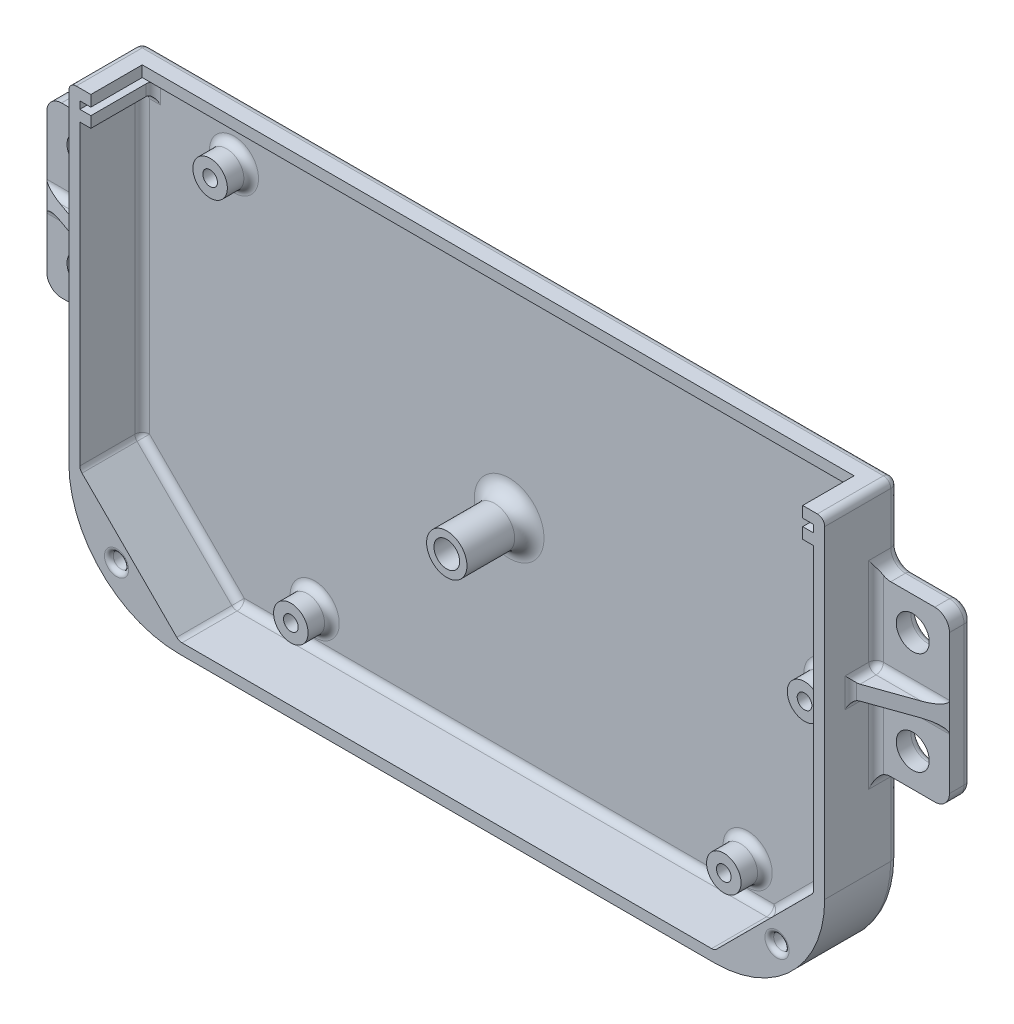
from build123d import *

# Parameters (mm, degrees)
BOSS_EXTRU_1_DEPTH      = 10
ENL_V_MAT_EXTRU_1_DEPTH = 8.5
ESQUISSE3_W             = 100
ESQUISSE3_H             = 1.5
BOSS_EXTRU_2_DEPTH      = 1.5
ESQUISSE4_W             = 1.5
ESQUISSE4_H             = 1.5
BOSS_EXTRU_3_DEPTH      = 8.5
ESQUISSE6_W             = 10
ESQUISSE6_H             = 23
ESQUISSE6_R             = 2.25
BOSS_EXTRU_5_DEPTH      = 3
CONG_3_R                = 2
CONG_4_R                = 1
CONG_5_R                = 1
BOSS_EXTRU_6_START      = 8.5
BOSS_EXTRU_6_DEPTH      = 8.5
ESQUISSE8_R             = 1.05
ENL_V_MAT_EXTRU_2_DEPTH = 5
CONG_6_R                = 1
ESQUISSE9_R             = 2.75
BOSS_EXTRU_7_DEPTH      = 8.5
CONG_7_R                = 2
ESQUISSE10_R            = 1.75
ENL_V_MAT_EXTRU_3_DEPTH = 10
CHANFREIN1_SIZE         = 2
ESQUISSE11_R            = 2.35
BOSS_EXTRU_8_DEPTH      = 3.25
ESQUISSE12_R            = 1
ENL_V_MAT_EXTRU_4_DEPTH = 2.5
CONG_8_R                = 1
CONG_9_R                = 0.6
BOSS_EXTRU_9_START      = -12
BOSS_EXTRU_9_DEPTH      = 2
CONG_10_R               = 1


# Read off the part's stored shape, not the designer's step: Boss.-Extru.9
with BuildPart() as part:
    # Esquisse1 → Boss.-Extru.1 (new body)
    with BuildSketch(Plane.XY):
        with BuildLine():
            Line((-51.5, 2), (51.5, 2))
            Line((51.5, 2), (51.5, -43))
            ThreePointArc((51.5, -43), (47.106601718, -53.606601718), (36.5, -58))
            Line((36.5, -58), (-36.5, -58))
            ThreePointArc((-36.5, -58), (-47.106601718, -53.606601718), (-51.5, -43))
            Line((-51.5, -43), (-51.5, 2))
        make_face()
    extrude(amount=BOSS_EXTRU_1_DEPTH)

    # Esquisse2 → Enlèv. mat.-Extru.1 (cut)
    with BuildSketch(Plane.XY.offset(10)):
        with BuildLine():
            Line((-50, 2), (50, 2))
            Line((50, 2), (50, -43))
            ThreePointArc((50, -43), (46.045941546, -52.545941546), (36.5, -56.5))
            Line((36.5, -56.5), (-36.5, -56.5))
            ThreePointArc((-36.5, -56.5), (-46.045941546, -52.545941546), (-50, -43))
            Line((-50, -43), (-50, 2))
        make_face()
    extrude(amount=-ENL_V_MAT_EXTRU_1_DEPTH, mode=Mode.SUBTRACT)

    # Esquisse3 → Boss.-Extru.2 (add)
    with BuildSketch(Plane.XY.offset(1.5)):
        with Locations((0, 1.25)):
            Rectangle(ESQUISSE3_W, ESQUISSE3_H)
    extrude(amount=BOSS_EXTRU_2_DEPTH)

    # Esquisse4 → Boss.-Extru.3 (add)
    with BuildSketch(Plane.XY.offset(1.5)):
        with Locations((-49.25, -1.25)):
            Rectangle(ESQUISSE4_W, ESQUISSE4_H)
        with Locations((49.25, -1.25)):
            Rectangle(ESQUISSE4_W, ESQUISSE4_H)
        with Locations((49.25, 1.25)):
            Rectangle(ESQUISSE4_W, ESQUISSE4_H)
        with Locations((-49.25, 1.25)):
            Rectangle(ESQUISSE4_W, ESQUISSE4_H)
    extrude(amount=BOSS_EXTRU_3_DEPTH)

    # Esquisse6 → Boss.-Extru.5 (add)
    # profile 1 of 2: a face of its own
    with BuildSketch(Plane(origin=(0, 0, 0), x_dir=(-1, 0, 0), z_dir=(0, 0, -1))):
        with Locations((-56.5, -19.5)):
            Rectangle(ESQUISSE6_W, ESQUISSE6_H)
        with Locations((-56.5, -12.5)):
            Circle(ESQUISSE6_R, mode=Mode.SUBTRACT)
        with Locations((-56.5, -26.5)):
            Circle(ESQUISSE6_R, mode=Mode.SUBTRACT)
    # profile 2 of 2: a face of its own
    with BuildSketch(Plane(origin=(0, 0, 0), x_dir=(-1, 0, 0), z_dir=(0, 0, -1))):
        with Locations((56.5, -19.5)):
            Rectangle(ESQUISSE6_W, ESQUISSE6_H)
        with Locations(Location((56.5, -12.5, 0), (0, 0, 180))):
            Circle(ESQUISSE6_R, mode=Mode.SUBTRACT)
        with Locations(Location((56.5, -26.5, 0), (0, 0, 180))):
            Circle(ESQUISSE6_R, mode=Mode.SUBTRACT)
    extrude(amount=-BOSS_EXTRU_5_DEPTH)

    # Congé3
    cong_3_edges = [part.edges().sort_by_distance(p)[0] for p in [
        (51.5, -8, 1.5),
        (51.5, -31, 1.5),
        (61.5, -31, 1.5),
        (61.5, -8, 1.5),
        (-51.5, -8, 1.5),
        (-61.5, -8, 1.5),
        (-61.5, -31, 1.5),
        (-51.5, -31, 1.5),
    ]]
    fillet(cong_3_edges, radius=CONG_3_R)

    # Congé4
    cong_4_edges = [part.edges().sort_by_distance(p)[0] for p in [
        (0, 2, 0),
        (51.5, -38, 0),
        (47.106601718, -53.606601718, 0),
        (58.75, -12.5, 0),
        (58.75, -26.5, 0),
        (-58.75, -12.5, 0),
        (-58.75, -26.5, 0),
        (0, -58, 0),
        (51.5, -2, 0),
        (56.5, -8, 0),
        (61.5, -19.5, 0),
        (56.5, -31, 0),
        (-51.5, -38, 0),
        (-56.5, -31, 0),
        (-61.5, -19.5, 0),
        (-56.5, -8, 0),
        (-60.914213562, -30.414213562, 0),
        (-60.914213562, -8.585786438, 0),
        (60.914213562, -30.414213562, 0),
        (60.914213562, -8.585786438, 0),
        (52.085786438, -7.414213562, 0),
        (52.085786438, -31.585786438, 0),
        (-52.085786438, -7.414213562, 0),
        (-52.085786438, -31.585786438, 0),
        (-47.106601718, -53.606601718, 0),
        (-51.5, -2, 0),
    ]]
    fillet(cong_4_edges, radius=CONG_4_R)

    # Congé5
    cong_5_edges = [part.edges().sort_by_distance(p)[0] for p in [
        (51.5, -19.5, 3),
        (-51.5, -19.5, 3),
    ]]
    fillet(cong_5_edges, radius=CONG_5_R)
    # the kernel refuses this fillet: 1 mm, written as the material it takes off along each edge
    with BuildSketch(Plane(origin=(-50.5, 1, 1), x_dir=(0, 1, 0), z_dir=(-1, 0, 0))) as cong_5_2_piece_1_section:
        Polygon((0, 0), (CONG_5_R * 1.02, 0), (CONG_5_R * 1.02, CONG_5_R * 1.02), (0, CONG_5_R * 1.02), align=None)
    cong_5_2_piece_1 = extrude(amount=CONG_5_R * 1.02, mode=Mode.PRIVATE)
    cong_5_2_piece_1 = cong_5_2_piece_1 - Plane(origin=(-50.5, 1, 1), x_dir=(0, -0.7071067811865475, 0.7071067811865475), z_dir=(-1, 0, 0)) * Sphere(CONG_5_R, mode=Mode.PRIVATE)
    add(cong_5_2_piece_1, mode=Mode.SUBTRACT)
    with BuildSketch(Plane(origin=(50.5, 1, 1), x_dir=(1, 0, 0), z_dir=(0, 1, 0))) as cong_5_2_piece_2_section:
        Polygon((0, 0), (CONG_5_R * 1.02, 0), (CONG_5_R * 1.02, CONG_5_R * 1.02), (0, CONG_5_R * 1.02), align=None)
    cong_5_2_piece_2 = extrude(amount=CONG_5_R * 1.02, mode=Mode.PRIVATE)
    cong_5_2_piece_2 = cong_5_2_piece_2 - Plane(origin=(50.5, 1, 1), x_dir=(-0.7071067811865475, 0, 0.7071067811865475), z_dir=(0, 1, 0)) * Sphere(CONG_5_R, mode=Mode.PRIVATE)
    add(cong_5_2_piece_2, mode=Mode.SUBTRACT)
    with BuildSketch(Plane(origin=(-51.5, 2, 1), x_dir=(0, -1, 0), z_dir=(0, 0, 1)), Plane(origin=(51.5, 2, 1), x_dir=(-1, 0, 0), z_dir=(0, 0, 1))) as cong_5_2_piece_3:
        with BuildLine():
            CenterArc((CONG_5_R, CONG_5_R), CONG_5_R, 180, 90)
            Line((0, CONG_5_R), (-CONG_5_R * 0.02, CONG_5_R))
            Line((-CONG_5_R * 0.02, CONG_5_R), (-CONG_5_R * 0.02, -CONG_5_R * 0.02))
            Line((-CONG_5_R * 0.02, -CONG_5_R * 0.02), (CONG_5_R, -CONG_5_R * 0.02))
            Line((CONG_5_R, -CONG_5_R * 0.02), (CONG_5_R, 0))
        make_face()
    extrude(amount=11.5, mode=Mode.SUBTRACT)

    # Esquisse7 → Boss.-Extru.6 (add)
    with BuildSketch(Plane.XY.offset(1.5).offset(BOSS_EXTRU_6_START)):
        with BuildLine():
            Line((-50, -43), (-36.5, -56.5))
            ThreePointArc((-36.5, -56.5), (-46.045941546, -52.545941546), (-50, -43))
        make_face()
        with BuildLine():
            Line((50, -43), (36.5, -56.5))
            ThreePointArc((36.5, -56.5), (46.045941546, -52.545941546), (50, -43))
        make_face()
    extrude(amount=-BOSS_EXTRU_6_DEPTH)

    # Esquisse8 → Enlèv. mat.-Extru.2 (cut)
    with BuildSketch(Plane.XY.offset(10)):
        with Locations((-45, -51.5)):
            Circle(ESQUISSE8_R)
        with Locations(Location((45, -51.5, 0), (0, 0, 180))):
            Circle(ESQUISSE8_R)
    extrude(amount=-ENL_V_MAT_EXTRU_2_DEPTH, mode=Mode.SUBTRACT)

    # Congé6
    cong_6_edges = [part.edges().sort_by_distance(p)[0] for p in [
        (43.25, -49.75, 1.5),
        (-43.25, -49.75, 1.5),
        (50, -22.5, 1.5),
        (-50, -43, 5.75),
        (-36.5, -56.5, 5.75),
        (0, -56.5, 1.5),
        (36.5, -56.5, 5.75),
        (50, -43, 5.75),
        (-50, -22.5, 1.5),
        (-48.5, -1.25, 1.5),
        (-49.25, -2, 1.5),
        (49.25, -2, 1.5),
        (48.5, -1.25, 1.5),
    ]]
    fillet(cong_6_edges, radius=CONG_6_R)

    # Esquisse9 → Boss.-Extru.7 (add)
    with BuildSketch(Plane.XY.offset(1.5)):
        with Locations(Location((0, -28, 0), (0, 0, 180))):
            Circle(ESQUISSE9_R)
    extrude(amount=BOSS_EXTRU_7_DEPTH)

    # Congé7
    cong_7_edges = [part.edges().sort_by_distance(p)[0] for p in [
        (2.75, -28, 1.5),
    ]]
    fillet(cong_7_edges, radius=CONG_7_R)

    # Esquisse10 → Enlèv. mat.-Extru.3 (cut)
    with BuildSketch(Plane.XY.offset(10)):
        with Locations((0, -28)):
            Circle(ESQUISSE10_R)
    extrude(amount=-ENL_V_MAT_EXTRU_3_DEPTH, mode=Mode.SUBTRACT)

    # Chanfrein1
    chanfrein1_edges = [part.edges().sort_by_distance(p)[0] for p in [
        (-1.75, -28, 0),
    ]]
    chamfer(chanfrein1_edges, length=CHANFREIN1_SIZE)

    # Esquisse11 → Boss.-Extru.8 (add)
    with BuildSketch(Plane.XY.offset(1.5)):
        with Locations(Location((-37.5, -5, 0), (0, 0, 180))):
            Circle(ESQUISSE11_R)
        with Locations(Location((43.5, -26.25, 0), (0, 0, 180))):
            Circle(ESQUISSE11_R)
        with Locations(Location((-26.5, -52, 0), (0, 0, 180))):
            Circle(ESQUISSE11_R)
        with Locations(Location((32.5, -52, 0), (0, 0, 180))):
            Circle(ESQUISSE11_R)
    extrude(amount=BOSS_EXTRU_8_DEPTH)

    # Esquisse12 → Enlèv. mat.-Extru.4 (cut)
    with BuildSketch(Plane.XY.offset(4.75)):
        with Locations((-37.5, -5)):
            Circle(ESQUISSE12_R)
        with Locations((-26.5, -52)):
            Circle(ESQUISSE12_R)
        with Locations((32.5, -52)):
            Circle(ESQUISSE12_R)
        with Locations((43.5, -26.25)):
            Circle(ESQUISSE12_R)
    extrude(amount=-ENL_V_MAT_EXTRU_4_DEPTH, mode=Mode.SUBTRACT)

    # Congé8
    cong_8_edges = [part.edges().sort_by_distance(p)[0] for p in [
        (-35.15, -5, 1.5),
        (45.85, -26.25, 1.5),
        (-24.15, -52, 1.5),
        (34.85, -52, 1.5),
    ]]
    fillet(cong_8_edges, radius=CONG_8_R)

    # Congé9
    cong_9_edges = [part.edges().sort_by_distance(p)[0] for p in [
        (-46.05, -51.5, 10),
        (46.05, -51.5, 10),
    ]]
    fillet(cong_9_edges, radius=CONG_9_R)

    # Boss.-Extru.9 outline → Boss.-Extru.9 (add)
    with BuildSketch(Plane.XZ.offset(31).offset(BOSS_EXTRU_9_START)):
        with BuildLine():
            Line((-51.5, 6.536882505), (-61.5, 3))
            Line((-61.5, 3), (-52.5, 3))
            ThreePointArc((-52.5, 3), (-51.792893219, 3.292893219), (-51.5, 4))
            Line((-51.5, 4), (-51.5, 6.536882505))
        make_face()
        with BuildLine():
            Line((61.5, 3), (51.5, 6.536882505))
            Line((51.5, 6.536882505), (51.5, 4))
            ThreePointArc((51.5, 4), (51.792893219, 3.292893219), (52.5, 3))
            Line((52.5, 3), (61.5, 3))
        make_face()
    extrude(amount=BOSS_EXTRU_9_DEPTH)

    # Congé10
    cong_10_edges = [part.edges().sort_by_distance(p)[0] for p in [
        (-51.792893219, -19, 3.292893219),
        (-51.792893219, -21, 3.292893219),
        (-51.5, -19, 5.268441253),
        (-51.5, -21, 5.268441253),
        (-57, -21, 3),
        (-57, -19, 3),
        (-51.5, -20, 6.536882505),
        (51.792893219, -19, 3.292893219),
        (51.792893219, -21, 3.292893219),
        (51.5, -19, 5.268441253),
        (51.5, -20, 6.536882505),
        (57, -21, 3),
        (51.5, -21, 5.268441253),
        (57, -19, 3),
    ]]
    fillet(cong_10_edges, radius=CONG_10_R)


solid = part.part
